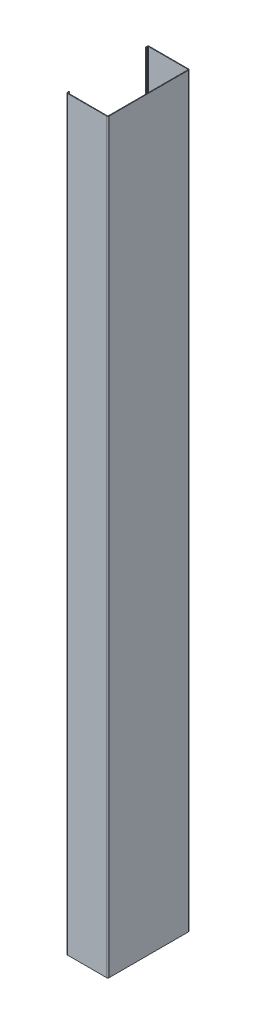
from build123d import *

# Parameters (mm, degrees)
MOVE_BODY_2_DEPTH    = 3000
SKETCH_6_OUTSIDE_W   = 652.406
SKETCH_6_OUTSIDE_H   = 3602.406
SKETCH_6_OUTSIDE_W_2 = 50
SKETCH_6_OUTSIDE_H_2 = 899.25
CUT_EXTRUDE_1_DEPTH  = 3003.033019472


# Read off the part's stored shape, not the designer's step: Тело-Переместить/Копировать2
with BuildPart() as part:
    # Move Body 2 outline → Move Body 2 (new body)
    with BuildSketch(Plane(origin=(0, 0, 0), x_dir=(1, 0, 0), z_dir=(0, 1, 0))):
        with BuildLine():
            Line((-50, 47.75), (-50, 46.25))
            Line((-50, 46.25), (-49.25, 46.25))
            Line((-49.25, 46.25), (-49.25, 47.75))
            ThreePointArc((-49.25, 47.75), (-49.030330086, 48.280330086), (-48.5, 48.5))
            Line((-48.5, 48.5), (-1.5, 48.5))
            ThreePointArc((-1.5, 48.5), (-0.969669914, 48.280330086), (-0.75, 47.75))
            Line((-0.75, 47.75), (-0.75, -47.75))
            ThreePointArc((-0.75, -47.75), (-0.969669914, -48.280330086), (-1.5, -48.5))
            Line((-1.5, -48.5), (-48.5, -48.5))
            ThreePointArc((-48.5, -48.5), (-49.030330086, -48.280330086), (-49.25, -47.75))
            Line((-49.25, -47.75), (-49.25, -46.25))
            Line((-49.25, -46.25), (-50, -46.25))
            Line((-50, -46.25), (-50, -47.75))
            ThreePointArc((-50, -47.75), (-49.560660172, -48.810660172), (-48.5, -49.25))
            Line((-48.5, -49.25), (-1.5, -49.25))
            ThreePointArc((-1.5, -49.25), (-0.439339828, -48.810660172), (0, -47.75))
            Line((0, -47.75), (0, 47.75))
            ThreePointArc((0, 47.75), (-0.439339828, 48.810660172), (-1.5, 49.25))
            Line((-1.5, 49.25), (-48.5, 49.25))
            ThreePointArc((-48.5, 49.25), (-49.560660172, 48.810660172), (-50, 47.75))
        make_face()
    extrude(amount=MOVE_BODY_2_DEPTH)

    # Эскиз6 outside → Вырез-Вытянуть1 (cut, through all)
    with BuildSketch(Plane(origin=(0, 0, -49.25), x_dir=(-1, 0, 0), z_dir=(0, 0, -1))):
        with Locations((25, 1500)):
            Rectangle(SKETCH_6_OUTSIDE_W, SKETCH_6_OUTSIDE_H)
        with Locations((25, 449.625)):
            Rectangle(SKETCH_6_OUTSIDE_W_2, SKETCH_6_OUTSIDE_H_2, mode=Mode.SUBTRACT)
    extrude(amount=-CUT_EXTRUDE_1_DEPTH, mode=Mode.SUBTRACT)


solid = part.part
